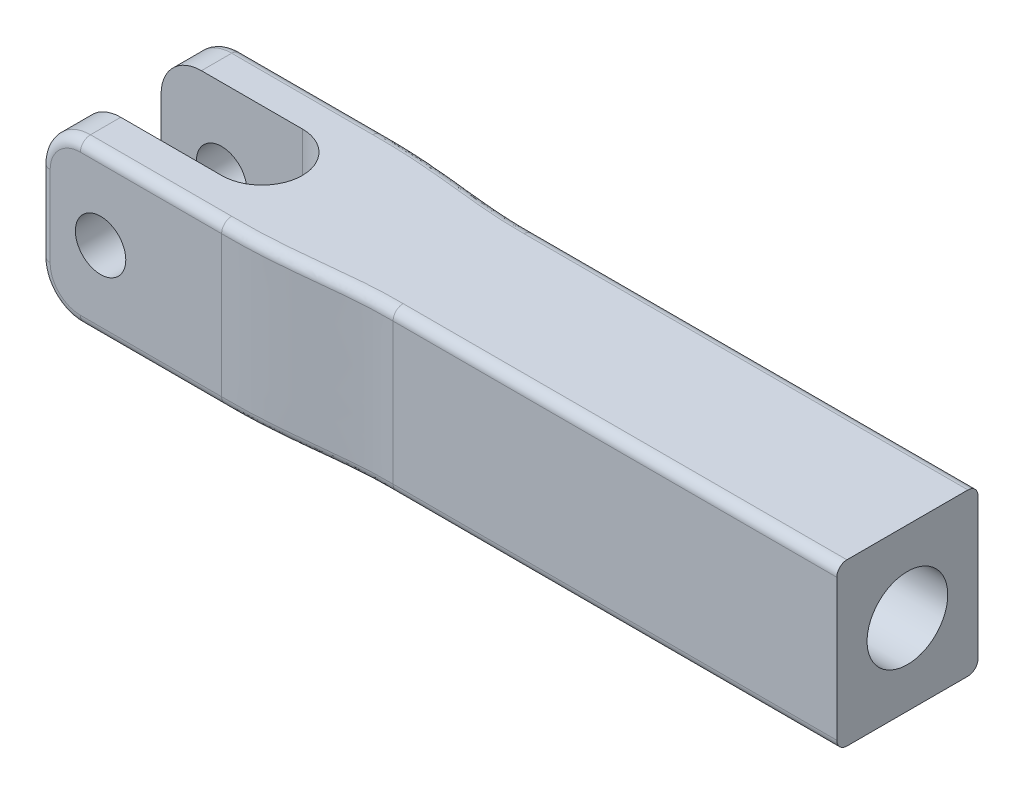
from build123d import *

# Parameters (mm, degrees)
BOSS_EXTRUDE1_DEPTH = 12.7
SKETCH2_R           = 3.96875
CUT_EXTRUDE1_DEPTH  = 63.5
SKETCH3_R           = 6.35
CUT_EXTRUDE2_DEPTH  = 76.2
FILLET1_R           = 6.35
FILLET2_R           = 6.35
FILLET3_R           = 1.5875


with BuildPart() as part:
    # Sketch1 → Boss-Extrude1 (new, symmetric)
    with BuildSketch(Plane(origin=(0, 0, 0), x_dir=(1, 0, 0), z_dir=(0, 1, 0))):
        with BuildLine():
            Line((19.05, -6.35), (19.05, 6.35))
            Line((19.05, 6.35), (-9.525, 6.35))
            Line((-9.525, 6.35), (-9.525, 12.7))
            Line((-9.525, 12.7), (19.05, 12.7))
            add(Edge.make_bspline(
                [(19.05, 12.7), (24.08504667, 12.7), (29.120093339, 12.7), (36.745860359, 11.1125), (40.597930179, 11.1125), (44.45, 11.1125)],
                knots=[0, 0, 0, 0, 0, 0, 1, 1, 1, 1, 1, 1], degree=5))
            Line((44.45, 11.1125), (114.3, 11.1125))
            Line((114.3, 11.1125), (114.3, -11.1125))
            Line((114.3, -11.1125), (44.45, -11.1125))
            add(Edge.make_bspline(
                [(19.05, -12.7), (24.08504667, -12.7), (29.120093339, -12.7), (36.745860359, -11.1125), (40.597930179, -11.1125), (44.45, -11.1125)],
                knots=[0, 0, 0, 0, 0, 0, 1, 1, 1, 1, 1, 1], degree=5))
            Line((19.05, -12.7), (-9.525, -12.7))
            Line((-9.525, -12.7), (-9.525, -6.35))
            Line((-9.525, -6.35), (19.05, -6.35))
        make_face()
    extrude(amount=BOSS_EXTRUDE1_DEPTH, both=True)

    # Sketch2 → Cut-Extrude1 (cut, symmetric)
    with BuildSketch(Plane.XY):
        Circle(SKETCH2_R)
    extrude(amount=CUT_EXTRUDE1_DEPTH, both=True, mode=Mode.SUBTRACT)

    # Sketch3 → Cut-Extrude2 (cut)
    with BuildSketch(Plane(origin=(114.3, 0, 0), x_dir=(0, 0, -1), z_dir=(1, 0, 0))):
        Circle(SKETCH3_R)
    extrude(amount=-CUT_EXTRUDE2_DEPTH, mode=Mode.SUBTRACT)

    # Fillet1
    fillet1_edges = [part.edges().sort_by_distance(p)[0] for p in [
        (19.05, 0, -6.35),
        (19.05, 0, 6.35),
    ]]
    fillet(fillet1_edges, radius=FILLET1_R - 0.0001)  # a hair under: the kernel refuses the full size

    # Fillet2
    fillet2_edges = [part.edges().sort_by_distance(p)[0] for p in [
        (-9.525, -12.7, -9.525),
        (-9.525, 12.7, 9.525),
        (-9.525, -12.7, 9.525),
        (-9.525, 12.7, -9.525),
    ]]
    fillet(fillet2_edges, radius=FILLET2_R)

    # Fillet3
    fillet3_edges = [part.edges().sort_by_distance(p)[0] for p in [
        (79.375, -12.7, -11.1125),
        (31.756356376, -12.7, -12.002478683),
        (7.9375, -12.7, -12.7),
        (-7.665128061, -10.840128061, -12.7),
        (-9.525, 0, -12.7),
        (-7.665128061, 10.840128061, -12.7),
        (7.9375, 12.7, -12.7),
        (31.756356376, 12.7, -12.002478683),
        (79.375, -12.7, 11.1125),
        (31.756356376, -12.7, 12.002478683),
        (7.9375, -12.7, 12.7),
        (-7.665128061, -10.840128061, 12.7),
        (-9.525, 0, 12.7),
        (-7.665128061, 10.840128061, 12.7),
        (7.9375, 12.7, 12.7),
        (31.756356376, 12.7, 12.002478683),
        (79.375, 12.7, -11.1125),
        (79.375, 12.7, 11.1125),
    ]]
    fillet(fillet3_edges, radius=FILLET3_R)


solid = part.part
